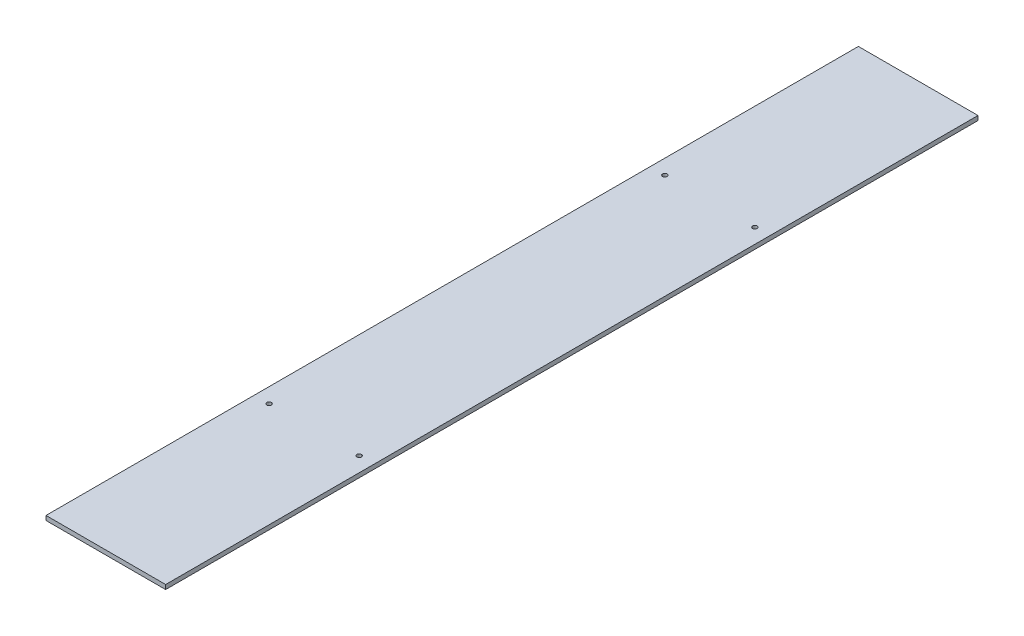
from build123d import *

# Parameters (mm, degrees)
SKETCH1_W           = 86.35
SKETCH1_H           = 586.35
SKETCH1_R           = 1.65
BOSS_EXTRUDE1_DEPTH = 3.175


with BuildPart() as part:
    # Sketch1 → Boss-Extrude1 (new body)
    with BuildSketch(Plane(origin=(0, 0, 0), x_dir=(1, 0, 0), z_dir=(0, 1, 0))):
        Rectangle(SKETCH1_W, SKETCH1_H)
        with Locations((-32.5, 142.8375)):
            Circle(SKETCH1_R, mode=Mode.SUBTRACT)
        with Locations((32.5, 142.8375)):
            Circle(SKETCH1_R, mode=Mode.SUBTRACT)
        with Locations((32.5, -142.8375)):
            Circle(SKETCH1_R, mode=Mode.SUBTRACT)
        with Locations((-32.5, -142.8375)):
            Circle(SKETCH1_R, mode=Mode.SUBTRACT)
    extrude(amount=BOSS_EXTRUDE1_DEPTH)


solid = part.part
